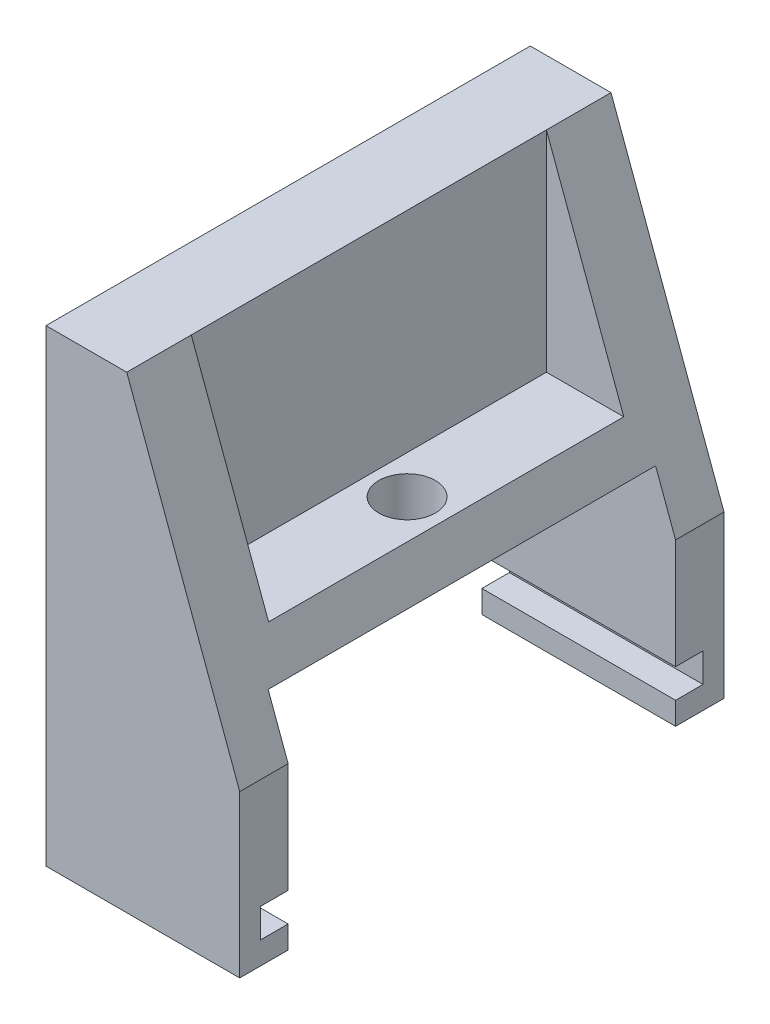
from build123d import *

# Parameters (mm, degrees)
BOSS_EXTRUDE1_DEPTH = 30
SKETCH4_W           = 24
SKETCH4_H           = 14
CUT_EXTRUDE2_DEPTH  = 25
SKETCH5_W           = 1.7
SKETCH5_H           = 1.8
CUT_EXTRUDE3_DEPTH  = 15
CUT_EXTRUDE4_DEPTH  = 11
SKETCH7_R           = 1.75
CUT_EXTRUDE5_DEPTH  = 4


with BuildPart() as part:
    # Sketch1 → Boss-Extrude1 (new body)
    with BuildSketch(Plane.XY):
        Polygon((0, 0), (0, -29), (12, -29), (12, -19), (5, 0), align=None)
    extrude(amount=-BOSS_EXTRUDE1_DEPTH)

    # Sketch4 → Cut-Extrude2 (cut)
    with BuildSketch(Plane.ZY):
        with Locations((-15, -22.638599401)):
            Rectangle(SKETCH4_W, SKETCH4_H)
    extrude(amount=-CUT_EXTRUDE2_DEPTH, mode=Mode.SUBTRACT)

    # Sketch5 → Cut-Extrude3 (cut)
    with BuildSketch(Plane.ZY):
        with Locations((-2.15, -26.7)):
            Rectangle(SKETCH5_W, SKETCH5_H)
    cut_extrude3 = extrude(amount=-CUT_EXTRUDE3_DEPTH, mode=Mode.SUBTRACT)

    # Mirror1: Cut-Extrude3 across plane
    add(cut_extrude3.mirror(Plane.XY.offset(-15)), mode=Mode.SUBTRACT)

    # Sketch6 → Cut-Extrude4 (cut, symmetric)
    with BuildSketch(Plane.XY.offset(-15)):
        Polygon((5, 0), (5, -13), (9.789473684, -13), align=None)
    extrude(amount=CUT_EXTRUDE4_DEPTH, both=True, mode=Mode.SUBTRACT)

    # Sketch7 → Cut-Extrude5 (cut)
    with BuildSketch(Plane(origin=(0, -13, 0), x_dir=(1, 0, 0), z_dir=(0, 1, 0))):
        with Locations((7.366665596, 15)):
            Circle(SKETCH7_R)
    extrude(amount=-CUT_EXTRUDE5_DEPTH, mode=Mode.SUBTRACT)


solid = part.part
